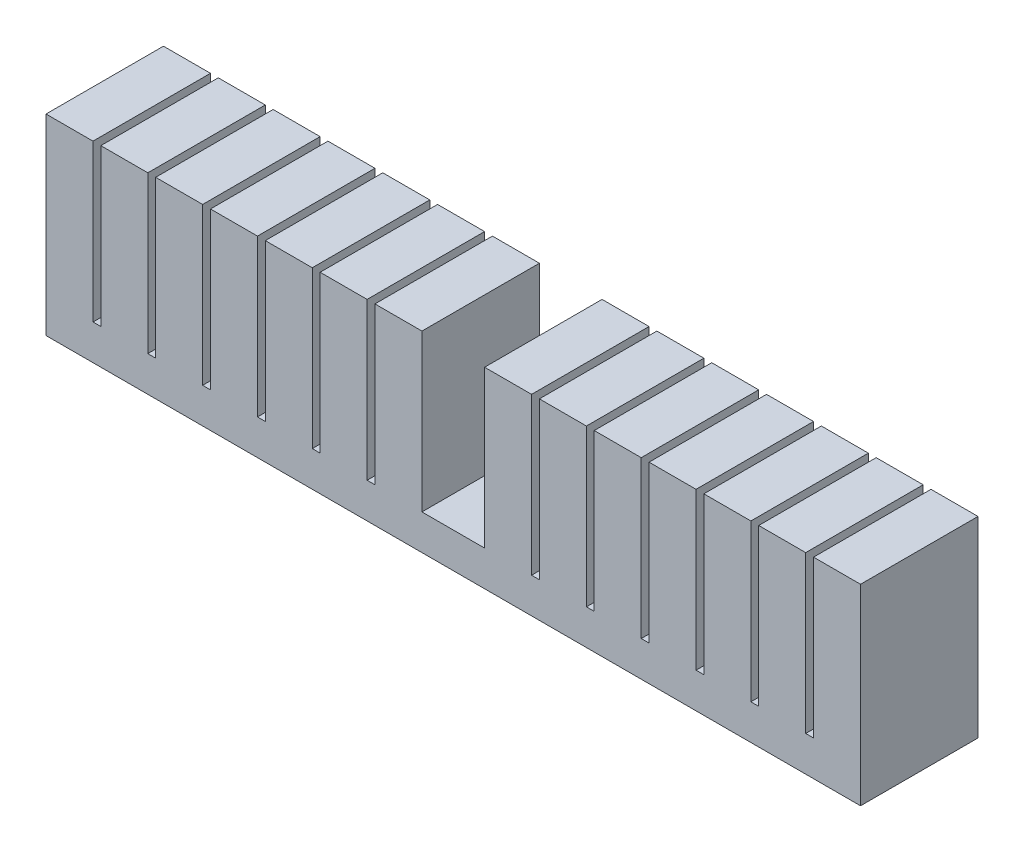
from build123d import *

# Parameters (mm, degrees)
BOSS_EXTRUDE1_DEPTH     = 7.5
LPATTERN1_COUNT         = 8
LPATTERN1_PITCH         = 7
LPATTERN1_COL_COUNT     = 8
LPATTERN1_COL_PITCH     = 7
SHELL2_T                = -1
CUT_EXTRUDE2_DEPTH      = 15
CUT_EXTRUDE2_DEPTH_BACK = 58.608593109
SKETCH3_W               = 0.5
SKETCH3_H               = 4.5
SKETCH4_W               = 13
SKETCH4_H               = 2.5
BOSS_EXTRUDE2_DEPTH     = 1
SKETCH5_W               = 13
SKETCH5_H               = 2.5
BOSS_EXTRUDE3_DEPTH     = 1
SKETCH8_W               = 6
SKETCH8_H               = 15
BOSS_EXTRUDE5_DEPTH     = 2
LPATTERN2_COUNT         = 15
LPATTERN2_PITCH         = 7
SKETCH10_W              = 6
SKETCH10_H              = 15
CUT_EXTRUDE4_DEPTH      = 20
SKETCH11_W              = 13
SKETCH11_H              = 1
BOSS_EXTRUDE6_DEPTH     = 4


# Read off the part's stored shape, not the designer's step: Split1
with BuildPart() as part:
    # Sketch1 → Boss-Extrude1 (new, symmetric)
    with BuildSketch(Plane.XY):
        Polygon((0, 0), (-3.5, 0), (-3.5, 4.5), (-3, 4.5), (-3, 22.5), (3, 22.5), (3, 4.5), (3.5, 4.5), (3.5, 0), align=None)
    boss_extrude1 = extrude(amount=BOSS_EXTRUDE1_DEPTH, both=True)

    # LPattern1: Boss-Extrude1 ×8
    with Locations(*[(-i * LPATTERN1_PITCH, 0, 0) for i in range(1, LPATTERN1_COUNT)]):
        add(boss_extrude1)


with BuildPart() as lpattern1_col_1:
    # LPattern1 col: pattern copy
    add(boss_extrude1.moved(Location(Vector(1, 0, 0) * (1 * LPATTERN1_COL_PITCH))))


with BuildPart() as lpattern1_col_2:
    # LPattern1 col: pattern copy
    add(boss_extrude1.moved(Location(Vector(1, 0, 0) * (2 * LPATTERN1_COL_PITCH))))


with BuildPart() as lpattern1_col_3:
    # LPattern1 col: pattern copy
    add(boss_extrude1.moved(Location(Vector(1, 0, 0) * (3 * LPATTERN1_COL_PITCH))))


with BuildPart() as lpattern1_col_4:
    # LPattern1 col: pattern copy
    add(boss_extrude1.moved(Location(Vector(1, 0, 0) * (4 * LPATTERN1_COL_PITCH))))


with BuildPart() as lpattern1_col_5:
    # LPattern1 col: pattern copy
    add(boss_extrude1.moved(Location(Vector(1, 0, 0) * (5 * LPATTERN1_COL_PITCH))))


with BuildPart() as lpattern1_col_6:
    # LPattern1 col: pattern copy
    add(boss_extrude1.moved(Location(Vector(1, 0, 0) * (6 * LPATTERN1_COL_PITCH))))


with BuildPart() as lpattern1_col_7:
    # LPattern1 col: pattern copy
    add(boss_extrude1.moved(Location(Vector(1, 0, 0) * (7 * LPATTERN1_COL_PITCH))))


with BuildPart() as part_1:
    add(part.part)

    # LPattern1 col united with what the copie: union LPattern1 col_1, LPattern1 col_2, LPattern1 col_3, LPattern1 col_4, LPattern1 col_5, LPattern1 col_6, LPattern1 col_7
    add(lpattern1_col_1.part)
    add(lpattern1_col_2.part)
    add(lpattern1_col_3.part)
    add(lpattern1_col_4.part)
    add(lpattern1_col_5.part)
    add(lpattern1_col_6.part)
    add(lpattern1_col_7.part)

    # Shell2
    shell2_openings = [part_1.faces().sort_by_distance(p)[0] for p in [
        (52.5, 2.25, 0),
        (-52.5, 2.25, 0),
    ]]
    offset(amount=SHELL2_T, openings=shell2_openings, kind=Kind.INTERSECTION)

    # Sketch3 → Cut-Extrude2 (cut, two sides: drawn at the far end of the back side and taken through both)
    with BuildSketch(Plane.XY.offset(-CUT_EXTRUDE2_DEPTH_BACK)):
        with Locations((-52.25, 2.25)):
            Rectangle(SKETCH3_W, SKETCH3_H)
        with Locations((52.25, 2.25)):
            Rectangle(SKETCH3_W, SKETCH3_H)
    extrude(amount=CUT_EXTRUDE2_DEPTH + CUT_EXTRUDE2_DEPTH_BACK, mode=Mode.SUBTRACT)

    # Sketch4 → Boss-Extrude2 (add)
    with BuildSketch(Plane.ZY.offset(52)):
        with Locations((0, 2.25)):
            Rectangle(SKETCH4_W, SKETCH4_H)
    extrude(amount=-BOSS_EXTRUDE2_DEPTH)

    # Sketch5 → Boss-Extrude3 (add)
    with BuildSketch(Plane(origin=(52, 0, 0), x_dir=(0, 0, -1), z_dir=(1, 0, 0))):
        with Locations((0, 2.25)):
            Rectangle(SKETCH5_W, SKETCH5_H)
    extrude(amount=-BOSS_EXTRUDE3_DEPTH)

    # Sketch8 → Boss-Extrude5 (add)
    with BuildSketch(Plane(origin=(0, 22.5, 0), x_dir=(1, 0, 0), z_dir=(0, 1, 0))):
        with Locations((-49, 0)):
            Rectangle(SKETCH8_W, SKETCH8_H)
    boss_extrude5 = extrude(amount=BOSS_EXTRUDE5_DEPTH)

    # LPattern2: Boss-Extrude5 ×15
    with Locations(*[(i * LPATTERN2_PITCH, 0, 0) for i in range(1, LPATTERN2_COUNT)]):
        add(boss_extrude5)


with BuildPart() as body_2:
    # Split1: the piece on the far side of the plane
    add(part_1.part)
    split(bisect_by=Plane(origin=(0, 1, 0), x_dir=(1, 0, 0), z_dir=(0, 1, 0)), keep=Keep.BOTTOM)


with BuildPart() as part_2:
    add(part_1.part)

    # Split1
    split(bisect_by=Plane(origin=(0, 1, 0), x_dir=(1, 0, 0), z_dir=(0, 1, 0)), keep=Keep.TOP)

    # Sketch10 → Cut-Extrude4 (cut)
    with BuildSketch(Plane(origin=(0, 24.5, 0), x_dir=(1, 0, 0), z_dir=(0, 1, 0))):
        Rectangle(SKETCH10_W, SKETCH10_H)
    extrude(amount=-CUT_EXTRUDE4_DEPTH, mode=Mode.SUBTRACT)

    # Sketch11 → Boss-Extrude6 (add)
    with BuildSketch(Plane(origin=(-2, 0, 0), x_dir=(0, 0, -1), z_dir=(1, 0, 0))):
        with Locations((0, 4)):
            Rectangle(SKETCH11_W, SKETCH11_H)
    extrude(amount=BOSS_EXTRUDE6_DEPTH)


with BuildPart() as body_2_1:
    add(body_2.part)

    # Combine1: union part
    add(part_2.part)


solid = body_2_1.part
